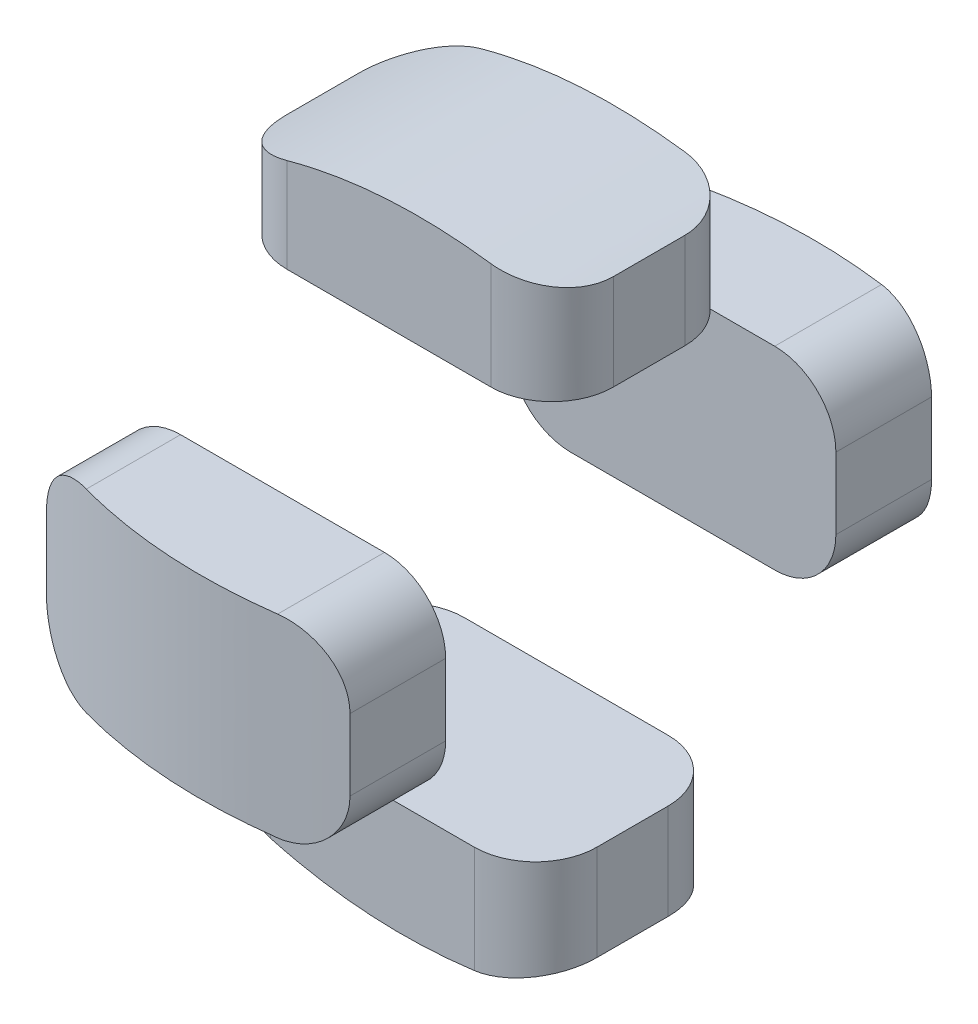
from build123d import *

# Parameters (mm, degrees)
BOSS_EXTRUDE1_DEPTH = 25
CUT_EXTRUDE2_DEPTH  = 111.491895737
CIRPATTERN1_COUNT   = 4


with BuildPart() as part:
    # Boss-Extrude1: read off the stored shape, not the designer's step
    # Boss-Extrude1 outline → Boss-Extrude1 (new body)
    with BuildSketch(Plane.XY.offset(-60)):
        with BuildLine():
            ThreePointArc((86.020947695, 4.927057714), (82.806879979, 12.686503583), (75.04743411, 15.900571299))
            Line((75.04743411, 15.900571299), (38.470208662, 15.900571299))
            ThreePointArc((38.470208662, 15.900571299), (30.710762792, 12.686503583), (27.496695077, 4.927057714))
            Line((27.496695077, 4.927057714), (27.496695077, -7.894515621))
            ThreePointArc((27.496695077, -7.894515621), (30.710762792, -15.653961491), (38.470208662, -18.868029207))
            Line((38.470208662, -18.868029207), (75.04743411, -18.868029207))
            ThreePointArc((75.04743411, -18.868029207), (82.806879979, -15.653961491), (86.020947695, -7.894515621))
            Line((86.020947695, -7.894515621), (86.020947695, 4.927057714))
        make_face()
    extrude(amount=BOSS_EXTRUDE1_DEPTH)

    # Sketch4 → Cut-Extrude2 (cut, through all)
    with BuildSketch(Plane.XZ.offset(18.868029207)):
        with BuildLine():
            Line((27.496695077, -60), (86.020947695, -60))
            Line((86.020947695, -60), (86.020947695, -52.158211588))
            add(Edge.make_bspline(
                [(27.496695077, -48.082361072), (54.507540596, -59.520866211), (86.020947695, -52.158211588)],
                knots=[0, 0, 0, 1, 1, 1], degree=2))
            Line((27.496695077, -48.082361072), (27.496695077, -60))
        make_face()
    extrude(amount=-CUT_EXTRUDE2_DEPTH, mode=Mode.SUBTRACT)


with BuildPart() as cirpattern1_1:
    # CirPattern1: pattern copy
    add(part.part.rotate(Axis((0, 0, 0), (-1, 0, 0)), 1 * 360 / CIRPATTERN1_COUNT))


with BuildPart() as cirpattern1_2:
    # CirPattern1: pattern copy
    add(part.part.rotate(Axis((0, 0, 0), (-1, 0, 0)), 2 * 360 / CIRPATTERN1_COUNT))


with BuildPart() as cirpattern1_3:
    # CirPattern1: pattern copy
    add(part.part.rotate(Axis((0, 0, 0), (-1, 0, 0)), 3 * 360 / CIRPATTERN1_COUNT))


solid = Compound([part.part, cirpattern1_1.part, cirpattern1_2.part, cirpattern1_3.part])
